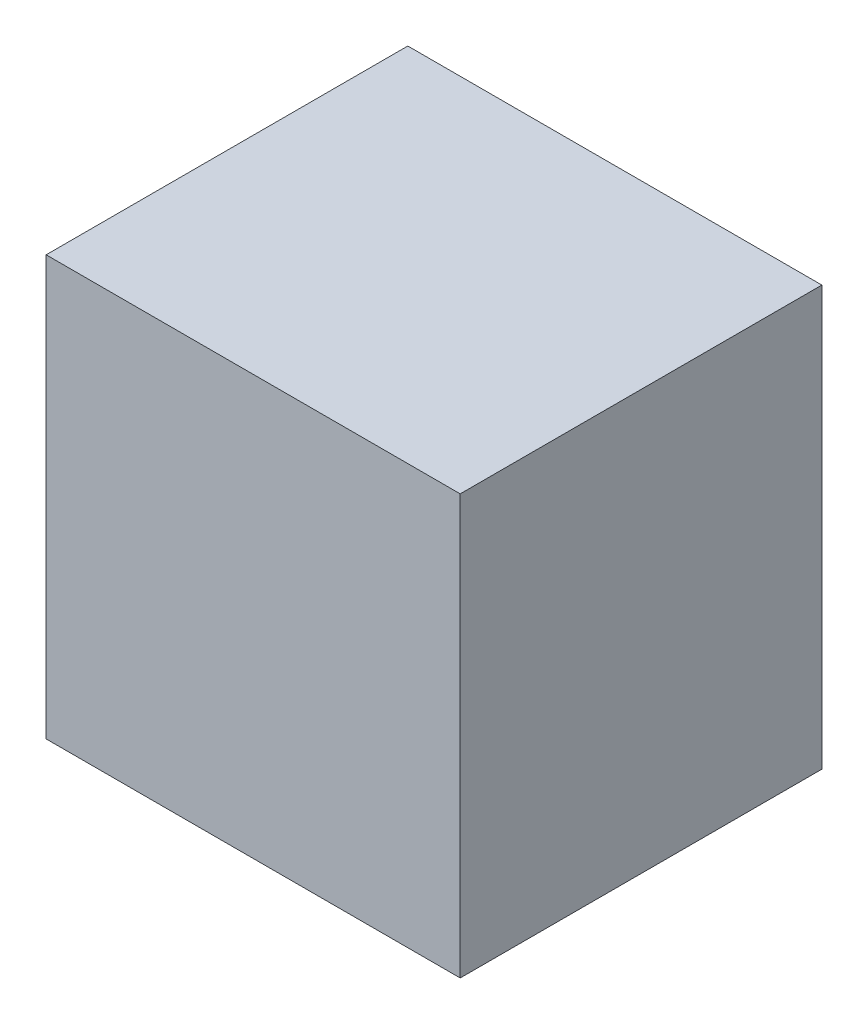
from build123d import *

# Parameters (mm, degrees)
SKETCH1_W           = 7.9
SKETCH1_H           = 6.9
BOSS_EXTRUDE1_DEPTH = 8
SKETCH2_W           = 5
SKETCH2_H           = 4
CUT_EXTRUDE1_DEPTH  = 2


with BuildPart() as part:
    # Sketch1 → Boss-Extrude1 (new body)
    with BuildSketch(Plane(origin=(0, 0, 0), x_dir=(1, 0, 0), z_dir=(0, 1, 0))):
        Rectangle(SKETCH1_W, SKETCH1_H)
    extrude(amount=BOSS_EXTRUDE1_DEPTH)

    # Sketch2 → Cut-Extrude1 (cut)
    with BuildSketch(Plane(origin=(0, 0, -3.45), x_dir=(-1, 0, 0), z_dir=(0, 0, -1))):
        with Locations((0, 4.5)):
            Rectangle(SKETCH2_W, SKETCH2_H)
    extrude(amount=-CUT_EXTRUDE1_DEPTH, mode=Mode.SUBTRACT)


solid = part.part
